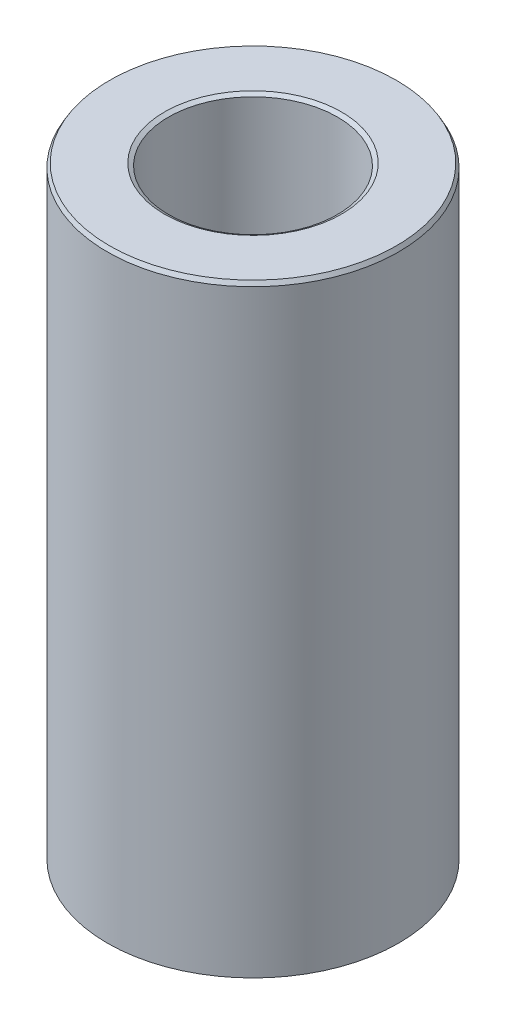
from build123d import *
from OCP.BRepFilletAPI import BRepFilletAPI_MakeChamfer

# Parameters (mm, degrees)
SKETCH1_R           = 40
BOSS_EXTRUDE1_DEPTH = 166.05841845
SKETCH2_R           = 23.192427166
CUT_EXTRUDE1_DEPTH  = 176.429183257
CHAMFER1_SIZE       = 1.116137999
CHAMFER1_SIZE2      = 0.644402574


with BuildPart() as part:
    # Sketch1 → Boss-Extrude1 (new body)
    with BuildSketch(Plane(origin=(0, 0, 0), x_dir=(1, 0, 0), z_dir=(0, 1, 0))):
        Circle(SKETCH1_R)
    extrude(amount=BOSS_EXTRUDE1_DEPTH)

    # Sketch2 → Cut-Extrude1 (cut, through all)
    with BuildSketch(Plane(origin=(0, 0, 0), x_dir=(1, 0, 0), z_dir=(0, 1, 0))):
        Circle(SKETCH2_R)
    extrude(amount=CUT_EXTRUDE1_DEPTH, mode=Mode.SUBTRACT)

    # Chamfer1: one chamfer whose edges measure the first distance from different faces: ONE call of the kernel's chamfer builder (chamfer() names one face for all edges)
    chamfer1_edges_1 = [part.edges().sort_by_distance(p)[0] for p in [
        (-23.192427166, 166.05841845, 0),
    ]]
    chamfer1_side_1 = [part.faces().sort_by_distance(p)[0] for p in [
        (-38.86862915, 166.05841845, 0),
    ]]
    chamfer1_edges_2 = [part.edges().sort_by_distance(p)[0] for p in [
        (-23.192427166, 0, 0),
    ]]
    chamfer1_side_2 = [part.faces().sort_by_distance(p)[0] for p in [
        (-23.192427166, 83.029209225, 0),
    ]]
    chamfer1_edges_3 = [part.edges().sort_by_distance(p)[0] for p in [
        (-40, 0, 0),
    ]]
    chamfer1_side_3 = [part.faces().sort_by_distance(p)[0] for p in [
        (-38.86862915, 0, 0),
    ]]
    chamfer1_edges_4 = [part.edges().sort_by_distance(p)[0] for p in [
        (-40, 166.05841845, 0),
    ]]
    chamfer1_side_4 = [part.faces().sort_by_distance(p)[0] for p in [
        (-40, 83.029209225, 0),
    ]]
    chamfer1 = BRepFilletAPI_MakeChamfer(part.part.solid().wrapped)
    for e in chamfer1_edges_1:
        chamfer1.Add(CHAMFER1_SIZE, CHAMFER1_SIZE2, e.wrapped, chamfer1_side_1[0].wrapped)  # the first distance lies on this face
    for e in chamfer1_edges_2:
        chamfer1.Add(CHAMFER1_SIZE, CHAMFER1_SIZE2, e.wrapped, chamfer1_side_2[0].wrapped)  # the first distance lies on this face
    for e in chamfer1_edges_3:
        chamfer1.Add(CHAMFER1_SIZE, CHAMFER1_SIZE2, e.wrapped, chamfer1_side_3[0].wrapped)  # the first distance lies on this face
    for e in chamfer1_edges_4:
        chamfer1.Add(CHAMFER1_SIZE, CHAMFER1_SIZE2, e.wrapped, chamfer1_side_4[0].wrapped)  # the first distance lies on this face
    add(Compound.cast(chamfer1.Shape()), mode=Mode.REPLACE)


solid = part.part
